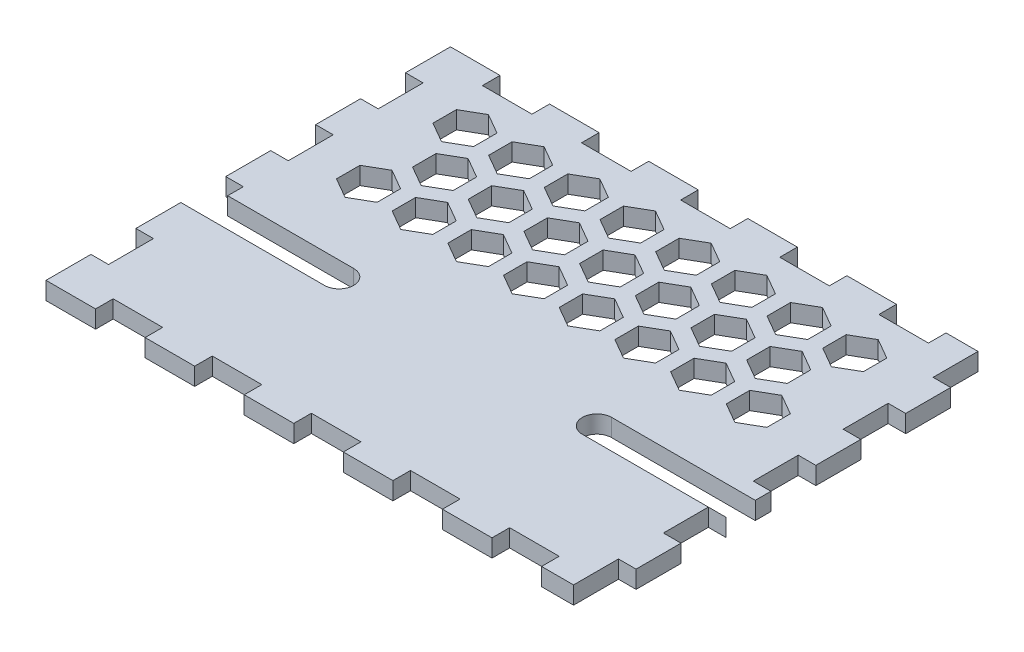
from build123d import *

# Parameters (mm, degrees)
AUFSATZ_LINEAR_AUSTRAGEN1_DEPTH = 3
SCHNITT_LINEAR_AUSTRAGEN2_DEPTH = 3
F_LLMUSTER1_DEPTH               = 3


# Read off the part's stored shape, not the designer's step: Füllmuster1
with BuildPart() as part:
    # Skizze1 → Aufsatz-Linear austragen1 (new body)
    with BuildSketch(Plane(origin=(0, 0, 0), x_dir=(1, 0, 0), z_dir=(0, 1, 0))):
        Polygon((0, 0.000138), (8.45439, 0.000138), (8.45439, 3.000132), (16.908526, 3.000132), (16.908526, 0.000138), (25.364186, 0.000138), (25.364186, 3.000132), (33.818576, 3.000132), (33.818576, 0.000138), (42.272712, 0.000138), (42.272712, 3.000132), (50.727102, 3.000132), (50.727102, 0.000138), (59.181492, 0.000138), (59.181492, 3.000132), (67.636898, 3.000132), (67.636898, 0.000138), (76.091034, 0.000138), (76.091034, 3.000132), (84.545424, 3.000132), (84.545424, 0.000138), (89.99982, 0.000138), (89.99982, 7.666366), (92.999814, 7.666366), (92.999814, 15.33361), (89.99982, 15.33361), (89.99982, 22.999838), (92.999814, 22.999838), (92.999814, 30.667082), (89.99982, 30.667082), (89.99982, 38.333056), (92.999814, 38.333056), (92.999814, 46.000554), (89.99982, 46.000554), (89.99982, 53.666528), (92.999814, 53.666528), (92.999814, 61.334026), (89.99982, 61.334026), (89.99982, 69), (84.545424, 69), (84.545424, 66.000006), (76.091034, 66.000006), (76.091034, 69), (67.636898, 69), (67.636898, 66.000006), (59.181492, 66.000006), (59.181492, 69), (50.727102, 69), (50.727102, 66.000006), (42.272712, 66.000006), (42.272712, 69), (33.818576, 69), (33.818576, 66.000006), (25.364186, 66.000006), (25.364186, 69), (16.908526, 69), (16.908526, 66.000006), (8.45439, 66.000006), (8.45439, 69), (0, 69), (0, 61.334026), (3.000248, 61.334026), (3.000248, 53.666528), (0, 53.666528), (0, 46.000554), (3.000248, 46.000554), (3.000248, 38.333056), (0, 38.333056), (0, 30.667082), (3.000248, 30.667082), (3.000248, 22.999838), (0, 22.999838), (0, 15.33361), (3.000248, 15.33361), (3.000248, 7.666366), (0, 7.666366), align=None)
    extrude(amount=AUFSATZ_LINEAR_AUSTRAGEN1_DEPTH)

    # Skizze3 → Schnitt-Linear austragen2 (cut)
    with BuildSketch(Plane.XZ):
        with BuildLine():
            Line((0, -23.000006), (24.5, -23.000006))
            ThreePointArc((24.5, -23.000006), (27, -25.500006), (24.5, -28.000006))
            Line((24.5, -28.000006), (0, -28.000006))
            Line((0, -28.000006), (0, -23.000006))
        make_face()
        with BuildLine():
            Line((92.999814, -23.000006), (92.999814, -28.000006))
            Line((92.999814, -28.000006), (68.499814, -28.000006))
            ThreePointArc((68.499814, -28.000006), (65.999814, -25.500006), (68.499814, -23.000006))
            Line((68.499814, -23.000006), (92.999814, -23.000006))
        make_face()
    extrude(amount=-SCHNITT_LINEAR_AUSTRAGEN2_DEPTH, mode=Mode.SUBTRACT)

    # Füllmuster1 outline → Füllmuster1 (cut)
    with BuildSketch(Plane(origin=(0, 0, 0), x_dir=(1, 0, 0), z_dir=(0, 1, 0))):
        Polygon((9.785932385, 39.772764664), (13.250034, 37.772764664), (16.714135615, 39.772764664), (16.714135615, 43.772764664), (13.250034, 45.772764664), (9.785932385, 43.772764664), align=None)
        Polygon((9.785932385, 60.227247336), (9.785932385, 56.227247336), (13.250034, 54.227247336), (16.714135615, 56.227247336), (16.714135615, 60.227247336), (13.250034, 62.227247336), align=None)
        Polygon((27.500034, 54.000006), (24.035932385, 52.000006), (24.035932385, 48.000006), (27.500034, 46.000006), (30.964135615, 48.000006), (30.964135615, 52.000006), align=None)
        Polygon((41.750034, 62.227247336), (38.285932385, 60.227247336), (38.285932385, 56.227247336), (41.750034, 54.227247336), (45.214135615, 56.227247336), (45.214135615, 60.227247336), align=None)
        Polygon((76.285932385, 39.772764664), (79.750034, 37.772764664), (83.214135615, 39.772764664), (83.214135615, 43.772764664), (79.750034, 45.772764664), (76.285932385, 43.772764664), align=None)
        Polygon((62.035932385, 48.000006), (65.500034, 46.000006), (68.964135615, 48.000006), (68.964135615, 52.000006), (65.500034, 54.000006), (62.035932385, 52.000006), align=None)
        Polygon((47.785932385, 56.227247336), (51.250034, 54.227247336), (54.714135615, 56.227247336), (54.714135615, 60.227247336), (51.250034, 62.227247336), (47.785932385, 60.227247336), align=None)
        Polygon((76.285932385, 60.227247336), (76.285932385, 56.227247336), (79.750034, 54.227247336), (83.214135615, 56.227247336), (83.214135615, 60.227247336), (79.750034, 62.227247336), align=None)
        Polygon((66.785932385, 39.772764664), (70.250034, 37.772764664), (73.714135615, 39.772764664), (73.714135615, 43.772764664), (70.250034, 45.772764664), (66.785932385, 43.772764664), align=None)
        Polygon((52.535932385, 48.000006), (56.000034, 46.000006), (59.464135615, 48.000006), (59.464135615, 52.000006), (56.000034, 54.000006), (52.535932385, 52.000006), align=None)
        Polygon((66.785932385, 60.227247336), (66.785932385, 56.227247336), (70.250034, 54.227247336), (73.714135615, 56.227247336), (73.714135615, 60.227247336), (70.250034, 62.227247336), align=None)
        Polygon((57.285932385, 39.772764664), (60.750034, 37.772764664), (64.214135615, 39.772764664), (64.214135615, 43.772764664), (60.750034, 45.772764664), (57.285932385, 43.772764664), align=None)
        Polygon((43.035932385, 48.000006), (46.500034, 46.000006), (49.964135615, 48.000006), (49.964135615, 52.000006), (46.500034, 54.000006), (43.035932385, 52.000006), align=None)
        Polygon((28.785932385, 56.227247336), (32.250034, 54.227247336), (35.714135615, 56.227247336), (35.714135615, 60.227247336), (32.250034, 62.227247336), (28.785932385, 60.227247336), align=None)
        Polygon((57.285932385, 60.227247336), (57.285932385, 56.227247336), (60.750034, 54.227247336), (64.214135615, 56.227247336), (64.214135615, 60.227247336), (60.750034, 62.227247336), align=None)
        Polygon((75.000034, 54.000006), (71.535932385, 52.000006), (71.535932385, 48.000006), (75.000034, 46.000006), (78.464135615, 48.000006), (78.464135615, 52.000006), align=None)
        Polygon((47.785932385, 39.772764664), (51.250034, 37.772764664), (54.714135615, 39.772764664), (54.714135615, 43.772764664), (51.250034, 45.772764664), (47.785932385, 43.772764664), align=None)
        Polygon((33.535932385, 48.000006), (37.000034, 46.000006), (40.464135615, 48.000006), (40.464135615, 52.000006), (37.000034, 54.000006), (33.535932385, 52.000006), align=None)
        Polygon((19.285932385, 56.227247336), (22.750034, 54.227247336), (26.214135615, 56.227247336), (26.214135615, 60.227247336), (22.750034, 62.227247336), (19.285932385, 60.227247336), align=None)
        Polygon((38.285932385, 39.772764664), (41.750034, 37.772764664), (45.214135615, 39.772764664), (45.214135615, 43.772764664), (41.750034, 45.772764664), (38.285932385, 43.772764664), align=None)
        Polygon((28.785932385, 39.772764664), (32.250034, 37.772764664), (35.714135615, 39.772764664), (35.714135615, 43.772764664), (32.250034, 45.772764664), (28.785932385, 43.772764664), align=None)
        Polygon((14.535932385, 48.000006), (18.000034, 46.000006), (21.464135615, 48.000006), (21.464135615, 52.000006), (18.000034, 54.000006), (14.535932385, 52.000006), align=None)
        Polygon((22.750034, 45.772764664), (19.285932385, 43.772764664), (19.285932385, 39.772764664), (22.750034, 37.772764664), (26.214135615, 39.772764664), (26.214135615, 43.772764664), align=None)
    extrude(amount=F_LLMUSTER1_DEPTH, mode=Mode.SUBTRACT)


solid = part.part
